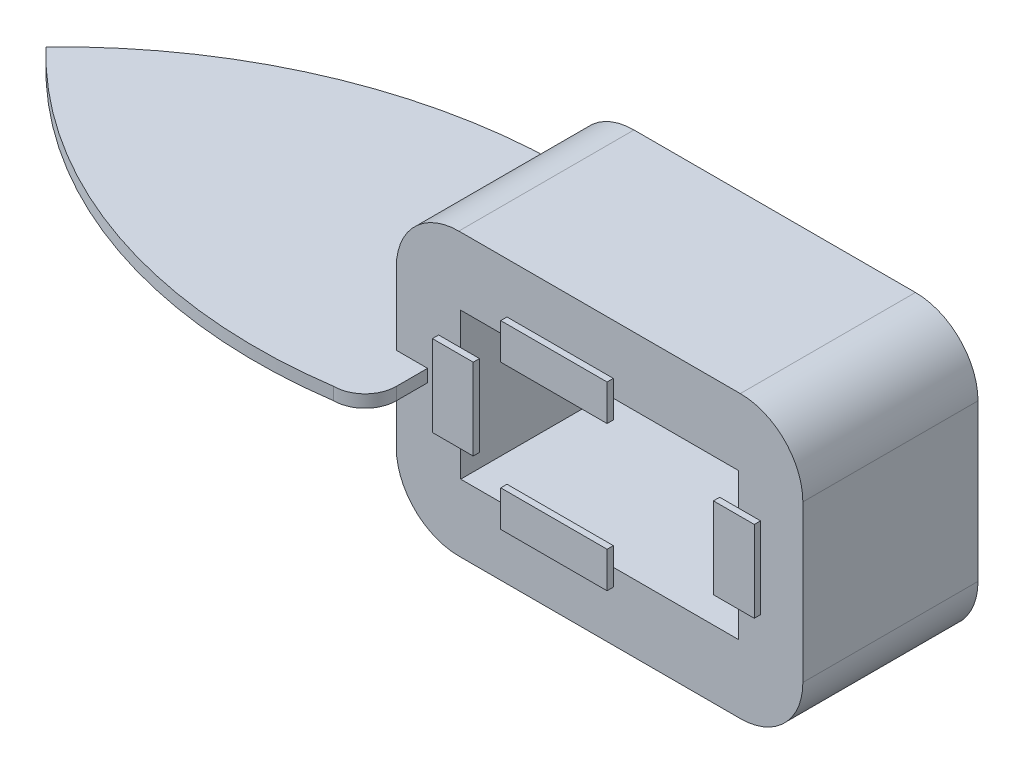
from build123d import *

# Parameters (mm, degrees)
SKETCH_1_W           = 65
SKETCH_1_H           = 45
EXTRUDE_1_DEPTH      = 28
SKETCH_2_W           = 44.4
SKETCH_2_H           = 23.4
CUT_EXTRUDE_1_DEPTH  = 39
FILLET_1_R           = 10
FILLET_2_R           = 10
FILLET_3_R           = 10
FILLET_4_R           = 10
EXTRUDE_6_DEPTH      = 1
EXTRUDE_6_2_DEPTH    = 1
EXTRUDE_6_3_DEPTH    = 1
SKETCH_10_W          = 17
SKETCH_10_H          = 5.754584259
EXTRUDE_6_4_DEPTH    = 1
SKETCH_20_W          = 5.002637397
SKETCH_20_H          = 2
EXTRUDE_7_DEPTH      = 10
SKETCH_21_W          = 5.00232547
SKETCH_21_H          = 2
EXTRUDE_8_DEPTH      = 10
EXTRUDE_9_DEPTH      = 1
EXTRUDE_9_DEPTH_BACK = 1
FILLET_5_R           = 5
FILLET_6_R           = 5


with BuildPart() as part:
    # 草圖1 → 填料-伸長1 (new body)
    with BuildSketch(Plane.XY):
        with Locations((-27.434655272, 0)):
            Rectangle(SKETCH_1_W, SKETCH_1_H)
    extrude(amount=EXTRUDE_1_DEPTH)

    # 草圖2 → 除料-伸長1 (cut)
    with BuildSketch(Plane.XY):
        with Locations((-27.434655272, 0)):
            Rectangle(SKETCH_2_W, SKETCH_2_H)
    extrude(amount=CUT_EXTRUDE_1_DEPTH, mode=Mode.SUBTRACT)

    # 圓角1
    fillet_1_edges = [part.edges().sort_by_distance(p)[0] for p in [
        (-59.934655272, -22.5, 14),
    ]]
    fillet(fillet_1_edges, radius=FILLET_1_R)

    # 圓角2
    fillet_2_edges = [part.edges().sort_by_distance(p)[0] for p in [
        (-59.934655272, 22.5, 14),
    ]]
    fillet(fillet_2_edges, radius=FILLET_2_R)

    # 圓角3
    fillet_3_edges = [part.edges().sort_by_distance(p)[0] for p in [
        (5.065344728, 22.5, 14),
    ]]
    fillet(fillet_3_edges, radius=FILLET_3_R)

    # 圓角4
    fillet_4_edges = [part.edges().sort_by_distance(p)[0] for p in [
        (5.065344728, -22.5, 14),
    ]]
    fillet(fillet_4_edges, radius=FILLET_4_R)

    # 草圖20 → 填料-伸長7 (add)
    with BuildSketch(Plane.XY.offset(28)):
        with Locations((-57.433336574, 0)):
            Rectangle(SKETCH_20_W, SKETCH_20_H)
    extrude(amount=EXTRUDE_7_DEPTH)

    # 草圖21 → 填料-伸長8 (add)
    with BuildSketch(Plane(origin=(0, 0, 0), x_dir=(-1, 0, 0), z_dir=(0, 0, -1))):
        with Locations((57.433492537, 0)):
            Rectangle(SKETCH_21_W, SKETCH_21_H)
    extrude(amount=EXTRUDE_8_DEPTH)

    # 草圖22 → 填料-伸長9 (add, two sides: drawn at the far end of the back side and taken through both)
    with BuildSketch(Plane(origin=(0, 0, 0), x_dir=(1, 0, 0), z_dir=(0, 1, 0)).offset(-EXTRUDE_9_DEPTH_BACK)):
        with BuildLine():
            Line((-59.934655272, 10), (-59.934655272, -38))
            ThreePointArc((-59.934655272, -38), (-97.835563119, -34.46098122), (-129.934655272, -14))
            ThreePointArc((-129.934655272, -14), (-97.835563119, 6.46098122), (-59.934655272, 10))
        make_face()
    extrude(amount=EXTRUDE_9_DEPTH + EXTRUDE_9_DEPTH_BACK)

    # 圓角5
    fillet_5_edges = [part.edges().sort_by_distance(p)[0] for p in [
        (-54.932329802, 0, -10),
    ]]
    fillet(fillet_5_edges, radius=FILLET_5_R)

    # 圓角6
    fillet_6_edges = [part.edges().sort_by_distance(p)[0] for p in [
        (-54.932017875, 0, 38),
    ]]
    fillet(fillet_6_edges, radius=FILLET_6_R)


with BuildPart() as body_2:
    # 草圖10 → 填料-伸長6 (new body)
    with BuildSketch(Plane.XY.offset(29)):
        Polygon((-49.634655272, 6.5), (-53.165057103, 6.5), (-53.165057103, -6.5), (-46.634655272, -6.5), (-46.634655272, 6.5), align=None)
    extrude(amount=-EXTRUDE_6_DEPTH)


with BuildPart() as body_3:
    # 草圖10 → Extrude 6 2 (new body)
    with BuildSketch(Plane.XY.offset(29)):
        Polygon((-42.234655272, -11.7), (-42.234655272, -8.7), (-25.234655272, -8.7), (-25.234655272, -14.454584259), (-42.234655272, -14.454584259), align=None)
    extrude(amount=-EXTRUDE_6_2_DEPTH)


with BuildPart() as body_4:
    # 草圖10 → Extrude 6 3 (new body)
    with BuildSketch(Plane.XY.offset(29)):
        Polygon((-8.234655272, 6.5), (-8.234655272, -6.5), (-5.234655272, -6.5), (-1.70425344, -6.5), (-1.70425344, 6.5), align=None)
    extrude(amount=-EXTRUDE_6_3_DEPTH)


with BuildPart() as body_5:
    # 草圖10 → Extrude 6 4 (new body)
    with BuildSketch(Plane.XY.offset(29)):
        with Locations((-33.734655272, 11.57729213)):
            Rectangle(SKETCH_10_W, SKETCH_10_H)
    extrude(amount=-EXTRUDE_6_4_DEPTH)


solid = Compound([part.part, body_2.part, body_3.part, body_4.part, body_5.part])
